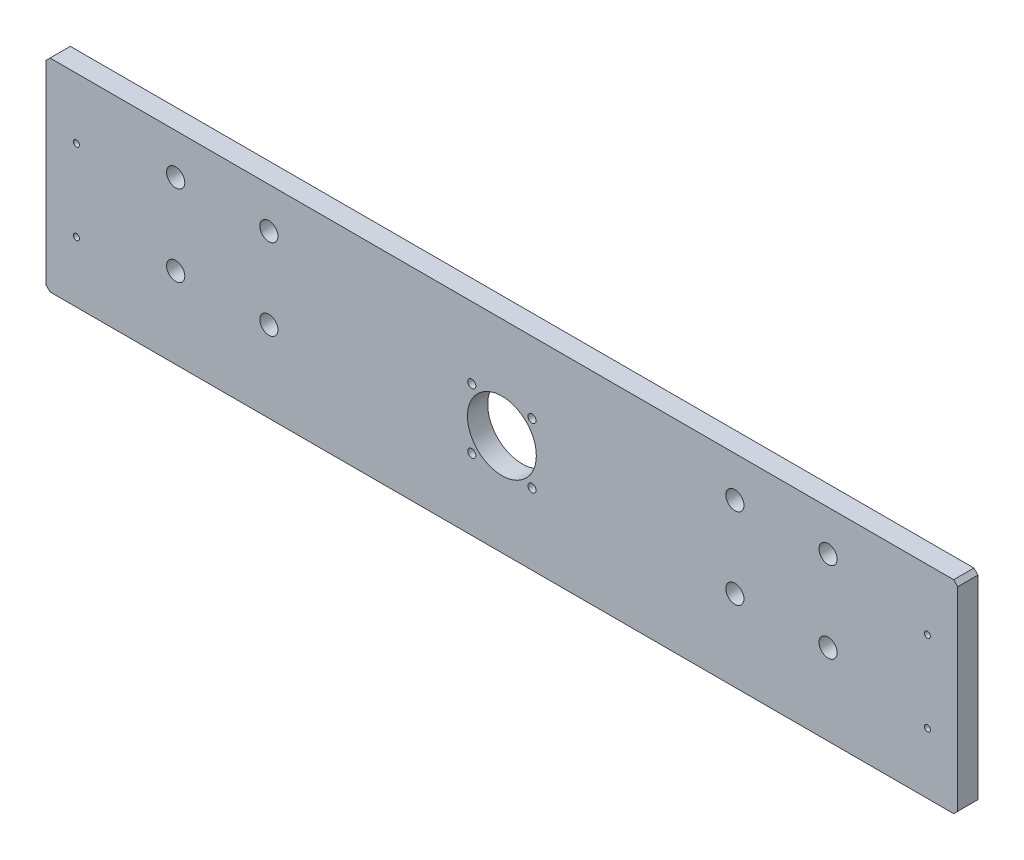
from build123d import *

# Parameters (mm, degrees)
SCHIZZO1_R          = 17
SCHIZZO1_R_2        = 2
SCHIZZO1_R_3        = 4.5
SCHIZZO1_R_4        = 1.5
BOSS_EXTRUDE1_DEPTH = 10


with BuildPart() as part:
    # Schizzo1 → Boss-Extrude1 (new body)
    with BuildSketch(Plane.XY):
        Polygon((2, 0), (448, 0), (450, 2), (450, 98), (448, 100), (2, 100), (0, 98), (0, 2), align=None)
        with Locations((225, 50)):
            Circle(SCHIZZO1_R, mode=Mode.SUBTRACT)
        with Locations((239.849242405, 64.849242405)):
            Circle(SCHIZZO1_R_2, mode=Mode.SUBTRACT)
        with Locations((239.849242405, 35.150757595)):
            Circle(SCHIZZO1_R_2, mode=Mode.SUBTRACT)
        with Locations((210.150757595, 35.150757595)):
            Circle(SCHIZZO1_R_2, mode=Mode.SUBTRACT)
        with Locations((386, 40)):
            Circle(SCHIZZO1_R_3, mode=Mode.SUBTRACT)
        with Locations((386, 80)):
            Circle(SCHIZZO1_R_3, mode=Mode.SUBTRACT)
        with Locations((340, 40)):
            Circle(SCHIZZO1_R_3, mode=Mode.SUBTRACT)
        with Locations((340, 80)):
            Circle(SCHIZZO1_R_3, mode=Mode.SUBTRACT)
        with Locations((435, 70)):
            Circle(SCHIZZO1_R_4, mode=Mode.SUBTRACT)
        with Locations((435, 30)):
            Circle(SCHIZZO1_R_4, mode=Mode.SUBTRACT)
        with Locations((15, 30)):
            Circle(SCHIZZO1_R_4, mode=Mode.SUBTRACT)
        with Locations((210.150757595, 64.849242405)):
            Circle(SCHIZZO1_R_2, mode=Mode.SUBTRACT)
        with Locations((15, 70)):
            Circle(SCHIZZO1_R_4, mode=Mode.SUBTRACT)
        with Locations((110, 80)):
            Circle(SCHIZZO1_R_3, mode=Mode.SUBTRACT)
        with Locations((110, 40)):
            Circle(SCHIZZO1_R_3, mode=Mode.SUBTRACT)
        with Locations((64, 80)):
            Circle(SCHIZZO1_R_3, mode=Mode.SUBTRACT)
        with Locations((64, 40)):
            Circle(SCHIZZO1_R_3, mode=Mode.SUBTRACT)
    extrude(amount=-BOSS_EXTRUDE1_DEPTH)


solid = part.part
